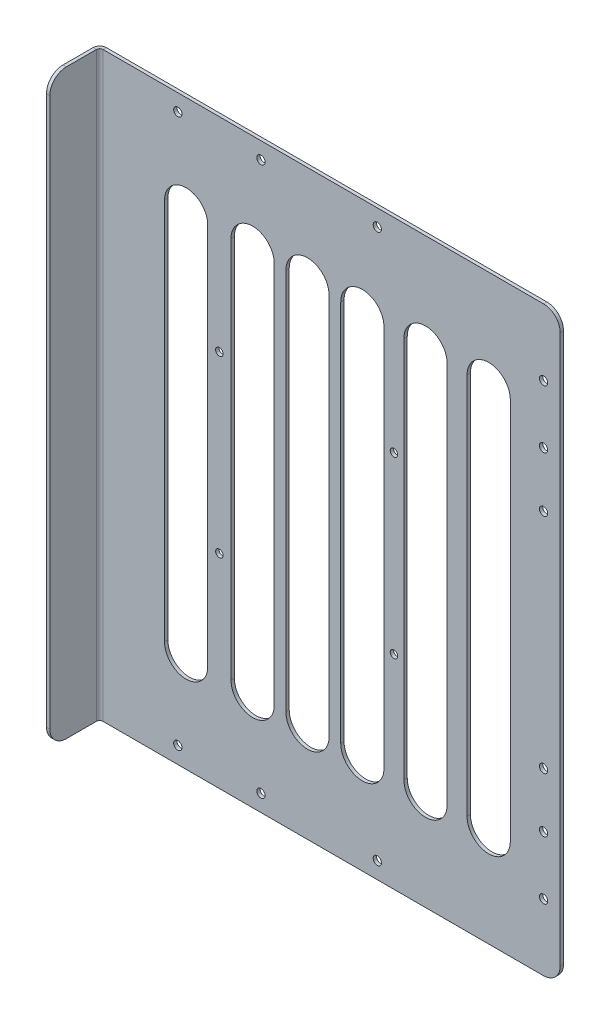
from build123d import *

# Parameters (mm, degrees)
SKETCH_1_W            = 280
SKETCH_1_H            = 350
EXTRUDE_1_DEPTH       = 2
SKETCH_2_W            = 1.551264613
SKETCH_2_H            = 30
EXTRUDE_2_DEPTH       = 350
EXTRUDE_3_DEPTH       = 350
SKETCH_3_R            = 2.5
CUT_EXTRUDE_1_DEPTH   = 1119.062393976
SHEET_START           = -330.973817188
SHEET_METAL_1_DEPTH   = 350
SHEET_METAL_1_2_DEPTH = 350
SKETCH_29_R           = 2.25
CUT_EXTRUDE_3_DEPTH   = 10
FILLET_1_R            = 10


# Read off the part's stored shape, not the designer's step: 솔리드-변환1
with BuildPart() as part:
    # 스케치1 → 보스-돌출1 (new body)
    with BuildSketch(Plane.XY):
        with Locations((905.507072504, -155.973817188)):
            Rectangle(SKETCH_1_W, SKETCH_1_H)
    extrude(amount=EXTRUDE_1_DEPTH)

    # 스케치2 → 보스-돌출2 (add)
    with BuildSketch(Plane(origin=(0, 19.026182812, 0), x_dir=(1, 0, 0), z_dir=(0, 1, 0))):
        with Locations((766.282704811, -17)):
            Rectangle(SKETCH_2_W, SKETCH_2_H)
    extrude(amount=-EXTRUDE_2_DEPTH)

    # 스케치10 → 보스-돌출3 (add)
    with BuildSketch(Plane(origin=(0, 19.026182812, 0), x_dir=(1, 0, 0), z_dir=(0, 1, 0))):
        Polygon((767.058337117, -2), (768.508337117, -2), (768.508337117, -6.001264612), (768.508337117, -32), (767.058337117, -32), align=None)
    extrude(amount=-EXTRUDE_3_DEPTH)

    # 스케치3 → 컷-돌출1 (cut, through all)
    with BuildSketch(Plane(origin=(1.179072504, 0, -191.38056669), x_dir=(1, 0, 0), z_dir=(0, 0, -1))):
        with Locations(Location((1034.328, 255.973817188, 0), (0, 0, 180))):
            Circle(SKETCH_3_R)
        with Locations(Location((1034.328, 55.973817188, 0), (0, 0, 180))):
            Circle(SKETCH_3_R)
        with Locations(Location((864.328, -9.026182812, 0), (0, 0, 180))):
            Circle(SKETCH_3_R)
        with Locations(Location((814.328, -9.026182812, 0), (0, 0, 180))):
            Circle(SKETCH_3_R)
        with Locations(Location((864.328, 320.973817188, 0), (0, 0, 180))):
            Circle(SKETCH_3_R)
        with Locations(Location((814.328, 320.973817188, 0), (0, 0, 180))):
            Circle(SKETCH_3_R)
        with Locations(Location((1034.328, 290.973817188, 0), (0, 0, 180))):
            Circle(SKETCH_3_R)
        with Locations(Location((1034.328, 20.973817188, 0), (0, 0, 180))):
            Circle(SKETCH_3_R)
        with Locations(Location((934.328, 320.973817188, 0), (0, 0, 180))):
            Circle(SKETCH_3_R)
        with Locations(Location((934.328, -9.026182812, 0), (0, 0, 180))):
            Circle(SKETCH_3_R)
        with Locations(Location((1034.328, 88.973817188, 0), (0, 0, 180))):
            Circle(SKETCH_3_R)
        with Locations(Location((1034.328, 222.973817188, 0), (0, 0, 180))):
            Circle(SKETCH_3_R)
    extrude(amount=-CUT_EXTRUDE_1_DEPTH, mode=Mode.SUBTRACT)

    # Sheet Metal 1 outline → Sheet Metal 1 (cut)
    with BuildSketch(Plane(origin=(0, 0, 0), x_dir=(1, 0, 0), z_dir=(0, 1, 0)).offset(SHEET_START)):
        with BuildLine():
            Line((765.507072504, -32), (766.508337117, -32))
            Line((766.508337117, -32), (766.508337117, -4))
            ThreePointArc((766.508337117, -4), (767.679909992, -1.171572875), (770.508337117, 0))
            Line((770.508337117, 0), (765.507072504, 0))
            Line((765.507072504, 0), (765.507072504, -32))
        make_face()
    extrude(amount=SHEET_METAL_1_DEPTH, mode=Mode.SUBTRACT)

    # Sheet Metal 1 2 outline → Sheet Metal 1 2 (add)
    with BuildSketch(Plane(origin=(0, 0, 0), x_dir=(1, 0, 0), z_dir=(0, 1, 0)).offset(SHEET_START)):
        with BuildLine():
            ThreePointArc((768.508337117, -4), (769.094123555, -2.585786438), (770.508337117, -2))
            Line((770.508337117, -2), (768.508337117, -2))
            Line((768.508337117, -2), (768.508337117, -4))
        make_face()
    extrude(amount=SHEET_METAL_1_2_DEPTH)

    # 스케치29 → 컷-돌출3 (cut)
    with BuildSketch(Plane.XY.offset(2)):
        with Locations((945.507072504, -103.473817188)):
            Circle(SKETCH_29_R)
        with Locations((945.507072504, -208.473817188)):
            Circle(SKETCH_29_R)
        with Locations((840.507072504, -103.473817188)):
            Circle(SKETCH_29_R)
        with Locations((840.507072504, -208.473817188)):
            Circle(SKETCH_29_R)
        with BuildLine():
            Line((1015.507072504, -40.973817188), (1015.507072504, -270.973817188))
            ThreePointArc((1015.507072504, -270.973817188), (1002.507072504, -283.973817188), (989.507072504, -270.973817188))
            Line((989.507072504, -270.973817188), (989.507072504, -40.973817188))
            ThreePointArc((989.507072504, -40.973817188), (1002.507072504, -27.973817188), (1015.507072504, -40.973817188))
        make_face()
        with BuildLine():
            Line((977.507072504, -40.973817188), (977.507072504, -270.973817188))
            ThreePointArc((977.507072504, -270.973817188), (964.507072504, -283.973817188), (951.507072504, -270.973817188))
            Line((951.507072504, -270.973817188), (951.507072504, -40.973817188))
            ThreePointArc((951.507072504, -40.973817188), (964.507072504, -27.973817188), (977.507072504, -40.973817188))
        make_face()
        with BuildLine():
            Line((939.507072504, -40.973817188), (939.507072504, -270.973817188))
            ThreePointArc((939.507072504, -270.973817188), (926.507072504, -283.973817188), (913.507072504, -270.973817188))
            Line((913.507072504, -270.973817188), (913.507072504, -40.973817188))
            ThreePointArc((913.507072504, -40.973817188), (926.507072504, -27.973817188), (939.507072504, -40.973817188))
        make_face()
        with BuildLine():
            Line((906.507072504, -40.973817188), (906.507072504, -270.973817188))
            ThreePointArc((906.507072504, -270.973817188), (893.507072504, -283.973817188), (880.507072504, -270.973817188))
            Line((880.507072504, -270.973817188), (880.507072504, -40.973817188))
            ThreePointArc((880.507072504, -40.973817188), (893.507072504, -27.973817188), (906.507072504, -40.973817188))
        make_face()
        with BuildLine():
            Line((873.507072504, -40.973817188), (873.507072504, -270.973817188))
            ThreePointArc((873.507072504, -270.973817188), (860.507072504, -283.973817188), (847.507072504, -270.973817188))
            Line((847.507072504, -270.973817188), (847.507072504, -40.973817188))
            ThreePointArc((847.507072504, -40.973817188), (860.507072504, -27.973817188), (873.507072504, -40.973817188))
        make_face()
        with BuildLine():
            Line((833.507072504, -40.973817188), (833.507072504, -270.973817188))
            ThreePointArc((833.507072504, -270.973817188), (820.507072504, -283.973817188), (807.507072504, -270.973817188))
            Line((807.507072504, -270.973817188), (807.507072504, -40.973817188))
            ThreePointArc((807.507072504, -40.973817188), (820.507072504, -27.973817188), (833.507072504, -40.973817188))
        make_face()
    extrude(amount=-CUT_EXTRUDE_3_DEPTH, mode=Mode.SUBTRACT)

    # 필렛1
    fillet_1_edges = [part.edges().sort_by_distance(p)[0] for p in [
        (1045.507072504, 19.026182812, 1),
        (1045.507072504, -330.973817188, 1),
        (767.508337117, -330.973817188, 32),
        (767.508337117, 19.026182812, 32),
    ]]
    fillet(fillet_1_edges, radius=FILLET_1_R)


solid = part.part
